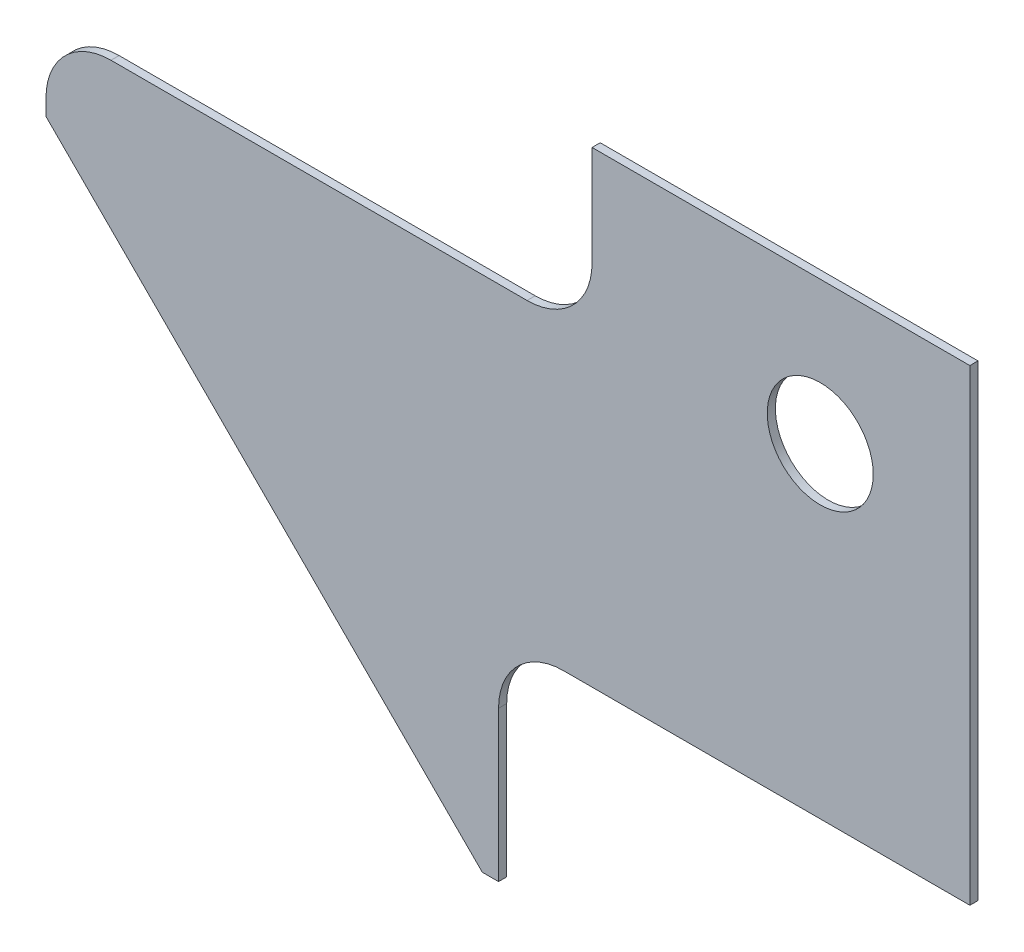
from build123d import *

# Parameters (mm, degrees)
SKETCH1_R           = 20.701
BOSS_EXTRUDE1_DEPTH = 3.175
SKETCH2_W           = 184.202806358
SKETCH2_H           = 84.074
CUT_EXTRUDE1_DEPTH  = 266.893552722
FILLET1_R           = 25.4
SKETCH4_W           = 213.36
SKETCH4_H           = 64.479988722
CUT_EXTRUDE2_DEPTH  = 266.893552722
FILLET2_R           = 25.4


with BuildPart() as part:
    # Sketch1 → Boss-Extrude1 (new body)
    with BuildSketch(Plane.XY):
        Polygon((-138.259383474, 48.991487021), (32.210627804, -121.478524257), (222.710627804, -121.478524257), (222.710627804, 145.221475743), (-138.259383474, 145.221475743), align=None)
        with Locations((164.245911629, 89.531975743)):
            Circle(SKETCH1_R, mode=Mode.SUBTRACT)
    extrude(amount=BOSS_EXTRUDE1_DEPTH)

    # Sketch2 → Cut-Extrude1 (cut, through all)
    with BuildSketch(Plane.XY.offset(3.175)):
        with Locations((130.662030983, -79.441524257)):
            Rectangle(SKETCH2_W, SKETCH2_H)
    extrude(amount=-CUT_EXTRUDE1_DEPTH, mode=Mode.SUBTRACT)

    # Fillet1
    fillet1_edges = [part.edges().sort_by_distance(p)[0] for p in [
        (38.560627804, -37.404524257, 1.5875),
    ]]
    fillet(fillet1_edges, radius=FILLET1_R)

    # Sketch4 → Cut-Extrude2 (cut, through all)
    with BuildSketch(Plane.XY.offset(3.175)):
        with Locations((-31.579383474, 112.981481382)):
            Rectangle(SKETCH4_W, SKETCH4_H)
    extrude(amount=-CUT_EXTRUDE2_DEPTH, mode=Mode.SUBTRACT)

    # Fillet2
    fillet2_edges = [part.edges().sort_by_distance(p)[0] for p in [
        (-138.259383474, 80.741487021, 1.5875),
        (75.100616526, 80.741487021, 1.5875),
    ]]
    fillet(fillet2_edges, radius=FILLET2_R)


solid = part.part
